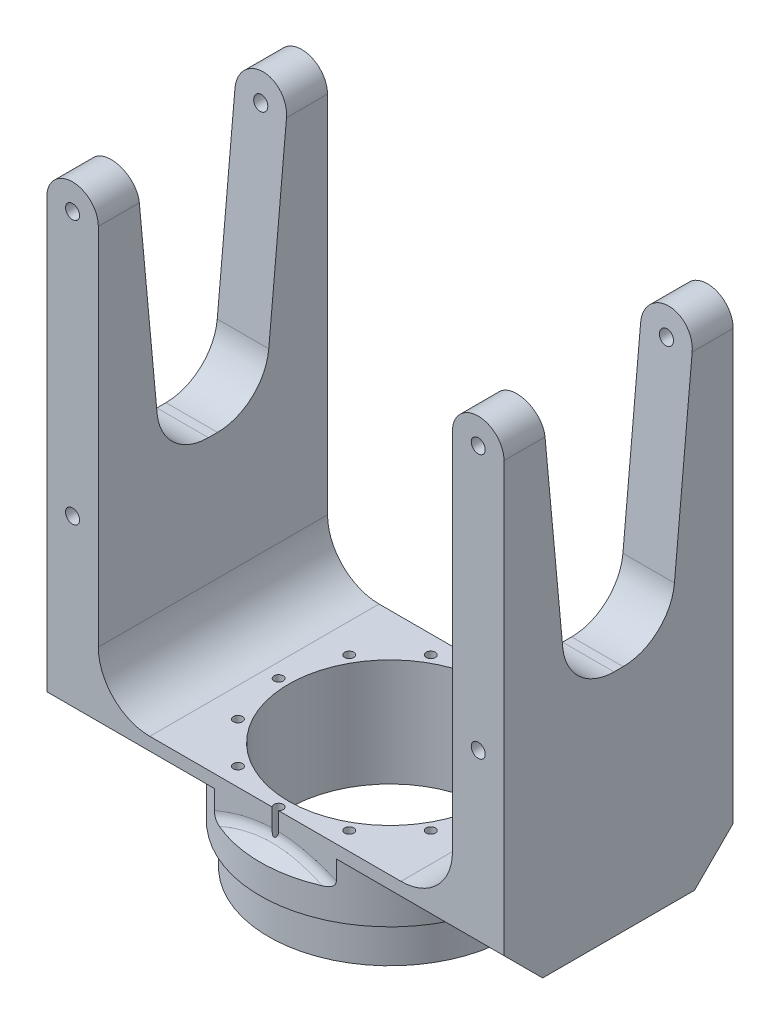
from build123d import *

# Parameters (mm, degrees)
SKETCH1_R                = 1.7272
BOSS_EXTRUDE1_DEPTH      = 56.5
BOSS_EXTRUDE1_2_DEPTH    = 56.5
SKETCH2_W                = 112.7
SKETCH2_H                = 12.7
BOSS_EXTRUDE2_DEPTH      = 56.5
FILLET1_R                = 12.7
CUT_EXTRUDE1_DEPTH       = 220.921758814
FILLET2_R                = 12.7
CHAMFER2_SIZE            = 9.525
BOSS_EXTRUDE3_DEPTH      = 4
BOSS_EXTRUDE3_DEPTH_BACK = 9.525
SKETCH5_R                = 32
SKETCH6_R                = 29.9
BOSS_EXTRUDE4_DEPTH      = 9.8
SKETCH7_R                = 25
CUT_EXTRUDE2_DEPTH       = 166.540048025
CHAMFER3_SIZE            = 6.35
FILLET3_R                = 3.175
SKETCH11_R               = 1.1303
CUT_EXTRUDE4_DEPTH       = 166.540048187


with BuildPart() as part:
    # Sketch1 → Boss-Extrude1 (new body)
    with BuildSketch(Plane.XY):
        with BuildLine():
            Line((61.15, -65), (61.15, -167.5))
            Line((61.15, -167.5), (73.85, -167.5))
            Line((73.85, -167.5), (73.85, -65))
            ThreePointArc((73.85, -65), (67.5, -58.65), (61.15, -65))
        make_face()
        with Locations(Location((67.5, -65, 0), (0, 0, 180))):
            Circle(SKETCH1_R, mode=Mode.SUBTRACT)
        with Locations(Location((67.5, -130, 0), (0, 0, 180))):
            Circle(SKETCH1_R, mode=Mode.SUBTRACT)
    extrude(amount=BOSS_EXTRUDE1_DEPTH)



with BuildPart() as body_2:
    # Sketch1 → Boss-Extrude1 2 (new body)
    with BuildSketch(Plane.XY):
        with BuildLine():
            Line((-26.15, -65), (-26.15, -167.5))
            Line((-26.15, -167.5), (-38.85, -167.5))
            Line((-38.85, -167.5), (-38.85, -65))
            ThreePointArc((-38.85, -65), (-32.5, -58.65), (-26.15, -65))
        make_face()
        with Locations(Location((-32.5, -130, 0), (0, 0, 180))):
            Circle(SKETCH1_R, mode=Mode.SUBTRACT)
        with Locations(Location((-32.5, -65, 0), (0, 0, 180))):
            Circle(SKETCH1_R, mode=Mode.SUBTRACT)
    extrude(amount=BOSS_EXTRUDE1_2_DEPTH)


with BuildPart() as part_1:
    add(part.part)

    add(body_2.part)  # Boss-Extrude2 merges body 2
    # Sketch2 → Boss-Extrude2 (add)
    with BuildSketch(Plane(origin=(0, 0, 0), x_dir=(-1, 0, 0), z_dir=(0, 0, -1))):
        with Locations((-17.5, -173.85)):
            Rectangle(SKETCH2_W, SKETCH2_H)
    extrude(amount=-BOSS_EXTRUDE2_DEPTH)

    # Fillet1
    fillet1_edges = [part_1.edges().sort_by_distance(p)[0] for p in [
        (61.15, -167.5, 28.25),
        (-26.15, -167.5, 28.25),
    ]]
    fillet(fillet1_edges, radius=FILLET1_R)

    # Sketch3 → Cut-Extrude1 (cut, through all)
    with BuildSketch(Plane(origin=(73.85, 0, 0), x_dir=(0, 0, -1), z_dir=(1, 0, 0))):
        Polygon((-15.55, -123.65), (-40.95, -123.65), (-46.975, -58.65), (-9.525, -58.65), align=None)
    extrude(amount=-CUT_EXTRUDE1_DEPTH, mode=Mode.SUBTRACT)

    # Fillet2
    fillet2_edges = [part_1.edges().sort_by_distance(p)[0] for p in [
        (67.5, -123.65, 15.55),
        (-32.5, -123.65, 15.55),
        (67.5, -123.65, 40.95),
        (-32.5, -123.65, 40.95),
    ]]
    fillet(fillet2_edges, radius=FILLET2_R)

    # Chamfer2
    chamfer2_edges = [part_1.edges().sort_by_distance(p)[0] for p in [
        (17.5, -180.2, 0),
        (17.5, -180.2, 56.5),
    ]]
    chamfer(chamfer2_edges, length=CHAMFER2_SIZE)

    # Sketch5 → Boss-Extrude3 (add, two sides: drawn at the far end of the back side and taken through both)
    with BuildSketch(Plane.XZ.offset(180.2).offset(-BOSS_EXTRUDE3_DEPTH_BACK)):
        with Locations(Location((17.5, 28.25, 0), (0, 0, 270))):
            Circle(SKETCH5_R)
    extrude(amount=BOSS_EXTRUDE3_DEPTH + BOSS_EXTRUDE3_DEPTH_BACK)

    # Sketch6 → Boss-Extrude4 (add)
    with BuildSketch(Plane.XZ.offset(184.2)):
        with Locations(Location((17.5, 28.25, 0), (0, 0, 270))):
            Circle(SKETCH6_R)
    extrude(amount=BOSS_EXTRUDE4_DEPTH)

    # Sketch7 → Cut-Extrude2 (cut, through all)
    with BuildSketch(Plane.XZ.offset(194)):
        with Locations(Location((17.5, 28.25, 0), (0, 0, 270))):
            Circle(SKETCH7_R)
    extrude(amount=-CUT_EXTRUDE2_DEPTH, mode=Mode.SUBTRACT)

    # Chamfer3
    # the kernel refuses this chamfer: 6.35 mm, written as the material it takes off along each edge
    with BuildSketch(Plane(origin=(17.5, -170.675, 28.25), x_dir=(0, 0, -1), z_dir=(-1, 0, 0))) as chamfer3_piece_1_section:
        Polygon((32 - CHAMFER3_SIZE, 0), (32, CHAMFER3_SIZE), (32, 0), align=None)
    chamfer3_piece_1 = revolve(axis=Axis((17.5, -170.675, 28.25), (0, -1, 0)), revolution_arc=57.256707861, mode=Mode.PRIVATE)
    chamfer3_piece_1 = split(chamfer3_piece_1, bisect_by=Plane(origin=(23.483585725, -173.207545132, 0), z_dir=(0, 0, -1)), keep=Keep.TOP, mode=Mode.PRIVATE)
    add(chamfer3_piece_1, mode=Mode.SUBTRACT)
    with BuildSketch(Plane(origin=(17.5, -170.675, 28.25), x_dir=(0.8411345691278422, 0, 0.5408258838277985), z_dir=(0.5408258838277985, 0, -0.8411345691278422))) as chamfer3_piece_2_section:
        Polygon((32 - CHAMFER3_SIZE, 0), (32, CHAMFER3_SIZE), (32, 0), align=None)
    chamfer3_piece_2 = revolve(axis=Axis((17.5, -170.675, 28.25), (0, -1, 0)), revolution_arc=114.520243901, mode=Mode.PRIVATE)
    chamfer3_piece_2 = split(chamfer3_piece_2, bisect_by=Plane(origin=(17.5, -173.207545388, 56.5), z_dir=(0, 0, 1)), keep=Keep.TOP, mode=Mode.PRIVATE)
    add(chamfer3_piece_2, mode=Mode.SUBTRACT)
    with BuildSketch(Plane(origin=(17.5, -170.675, 28.25), x_dir=(-0.8411023413818278, 0, -0.5408760036477928), z_dir=(-0.5408760036477928, 0, 0.8411023413818278))) as chamfer3_piece_3_section:
        Polygon((32 - CHAMFER3_SIZE, 0), (32, CHAMFER3_SIZE), (32, 0), align=None)
    chamfer3_piece_3 = revolve(axis=Axis((17.5, -170.675, 28.25), (0, -1, 0)), revolution_arc=57.256707861, mode=Mode.PRIVATE)
    chamfer3_piece_3 = split(chamfer3_piece_3, bisect_by=Plane(origin=(11.516414275, -173.207545132, 0), z_dir=(0, 0, -1)), keep=Keep.TOP, mode=Mode.PRIVATE)
    add(chamfer3_piece_3, mode=Mode.SUBTRACT)

    # Fillet3
    fillet3_edges = [part_1.edges().sort_by_distance(p)[0] for p in [
        (9.780769481, -174.310645286, 0),
        (17.5, -173.275, 56.5),
    ]]
    fillet(fillet3_edges, radius=FILLET3_R)

    # Sketch11 → Cut-Extrude4 (cut, through all)
    with BuildSketch(Plane.XZ.offset(194)):
        with Locations(Location((17.5, 55.7, 0), (0, 0, 270))):
            Circle(SKETCH11_R)
        with Locations(Location((31.225, 52.022397334, 0), (0, 0, 270))):
            Circle(SKETCH11_R)
        with Locations(Location((41.272397334, 41.975, 0), (0, 0, 270))):
            Circle(SKETCH11_R)
        with Locations(Location((44.95, 28.25, 0), (0, 0, 270))):
            Circle(SKETCH11_R)
        with Locations(Location((41.272397334, 14.525, 0), (0, 0, 270))):
            Circle(SKETCH11_R)
        with Locations(Location((31.225, 4.477602666, 0), (0, 0, 270))):
            Circle(SKETCH11_R)
        with Locations(Location((17.5, 0.8, 0), (0, 0, 270))):
            Circle(SKETCH11_R)
        with Locations(Location((3.775, 4.477602666, 0), (0, 0, 270))):
            Circle(SKETCH11_R)
        with Locations(Location((-6.272397334, 14.525, 0), (0, 0, 270))):
            Circle(SKETCH11_R)
        with Locations(Location((-9.95, 28.25, 0), (0, 0, 270))):
            Circle(SKETCH11_R)
        with Locations(Location((-6.272397334, 41.975, 0), (0, 0, 270))):
            Circle(SKETCH11_R)
        with Locations(Location((3.775, 52.022397334, 0), (0, 0, 270))):
            Circle(SKETCH11_R)
    extrude(amount=-CUT_EXTRUDE4_DEPTH, mode=Mode.SUBTRACT)


solid = part_1.part
